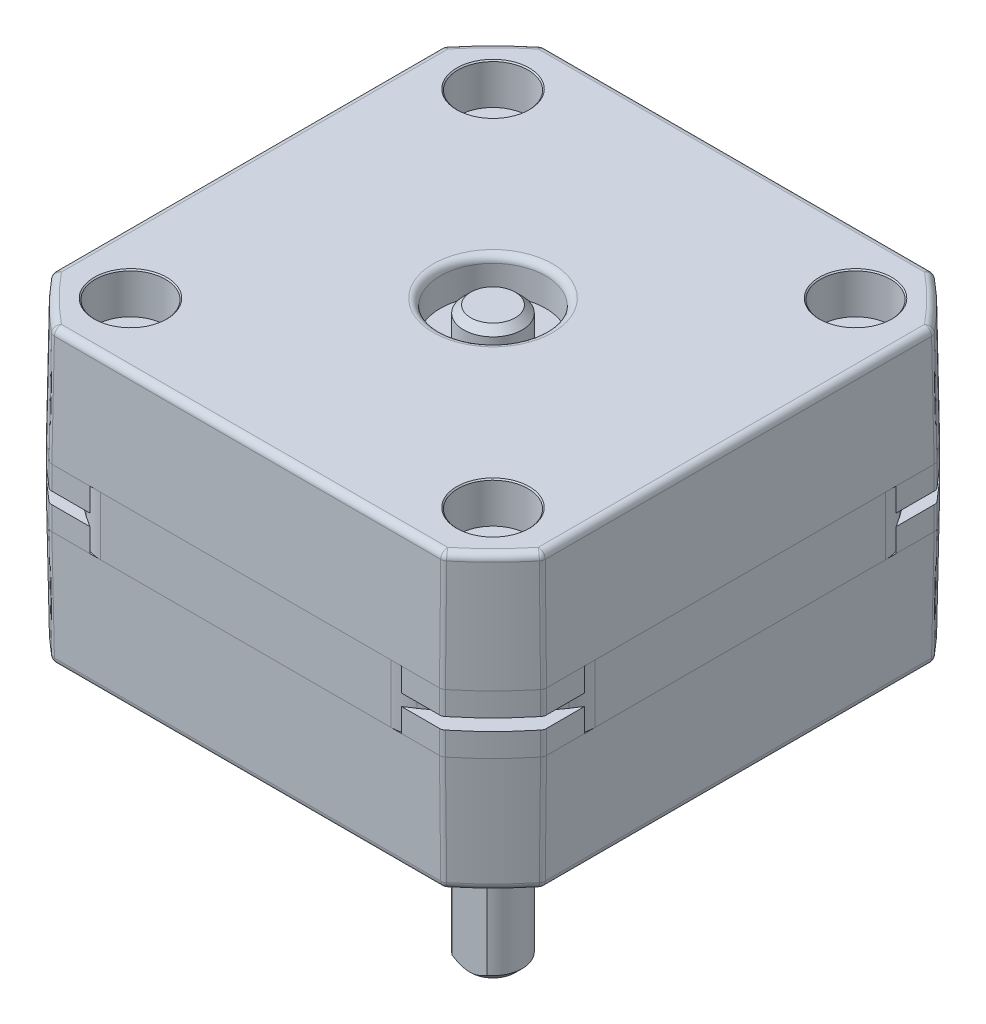
from build123d import *

# Parameters (mm, degrees)
SKETCH1_R                                   = 17.5
SKETCH1_R_2                                 = 1.75
CENTER_BODY_DEPTH                           = 5
TOP_CAP_BODY_DEPTH                          = 10
TOP_CAP_BODY_DRAFT                          = 1
TOP_CAP_BODY_OTHER_WAY_DEPTH                = 2
CUT_EXTRUDE1_START                          = -2
SKETCH4_R                                   = 25
CUT_EXTRUDE1_DEPTH                          = 2
FILLET3_R                                   = 3
CBORE_SLOT_FOR_M5_HEX_HEAD_BOLT1_AT_2_COUNT = 2
CBORE_SLOT_FOR_M5_HEX_HEAD_BOLT1_AT_2_PITCH = 31
CBORE_SLOT_FOR_M5_HEX_HEAD_BOLT1_AT_3_COUNT = 2
CBORE_SLOT_FOR_M5_HEX_HEAD_BOLT1_AT_3_PITCH = 43.840620434
CBORE_SLOT_FOR_M5_HEX_HEAD_BOLT1_AT_4_COUNT = 2
CBORE_SLOT_FOR_M5_HEX_HEAD_BOLT1_AT_4_PITCH = 31
SKETCH5_R                                   = 15.5
CUT_EXTRUDE2_DEPTH                          = 0.4
CUT_EXTRUDE2_DRAFT                          = -75
BOSS_EXTRUDE3_START                         = -0.4
SKETCH6_R                                   = 11
BOSS_EXTRUDE3_DEPTH                         = 2.4
M3_TAPPED_HOLE1_AT_2_COUNT                  = 2
M3_TAPPED_HOLE1_AT_2_PITCH                  = 31
M3_TAPPED_HOLE1_AT_3_COUNT                  = 2
M3_TAPPED_HOLE1_AT_3_PITCH                  = 43.840620434
M3_TAPPED_HOLE1_AT_4_COUNT                  = 2
M3_TAPPED_HOLE1_AT_4_PITCH                  = 31
SKETCH14_R                                  = 4.5
CUT_EXTRUDE3_DEPTH                          = 3
SKETCH15_R                                  = 2.5
BOSS_EXTRUDE4_DEPTH                         = 2.5
SKETCH16_R                                  = 4.5
CUT_EXTRUDE4_DEPTH                          = 3
SKETCH17_R                                  = 2.5
BOSS_EXTRUDE5_DEPTH                         = 25
CUT_EXTRUDE5_DEPTH                          = 20
SKETCH19_W                                  = 8
SKETCH19_H                                  = 7
CUT_EXTRUDE6_DEPTH                          = 4
FILLET1_R                                   = 0.6
FILLET2_R                                   = 0.6
CHAMFER1_SIZE                               = 0.6


with BuildPart() as part:
    # Sketch1 → center body (new body)
    with BuildSketch(Plane(origin=(0, 0, 0), x_dir=(1, 0, 0), z_dir=(0, 1, 0))):
        with BuildLine():
            Line((-21.15, 13.329572386), (-21.15, -13.329572386))
            ThreePointArc((-21.15, -13.329572386), (-17.67766953, -17.67766953), (-13.329572386, -21.15))
            Line((-13.329572386, -21.15), (13.329572386, -21.15))
            ThreePointArc((13.329572386, -21.15), (17.67766953, -17.67766953), (21.15, -13.329572386))
            Line((21.15, -13.329572386), (21.15, 13.329572386))
            ThreePointArc((21.15, 13.329572386), (17.67766953, 17.67766953), (13.329572386, 21.15))
            Line((13.329572386, 21.15), (-13.329572386, 21.15))
            ThreePointArc((-13.329572386, 21.15), (-17.67766953, 17.67766953), (-21.15, 13.329572386))
        make_face()
        with Locations(Location((0, 0, 0), (0, 0, 270))):
            Circle(SKETCH1_R, mode=Mode.SUBTRACT)
        with Locations(Location((-15.5, 15.5, 0), (0, 0, 270))):
            Circle(SKETCH1_R_2, mode=Mode.SUBTRACT)
        with Locations(Location((15.5, 15.5, 0), (0, 0, 90))):
            Circle(SKETCH1_R_2, mode=Mode.SUBTRACT)
        with Locations(Location((-15.5, -15.5, 0), (0, 0, 270))):
            Circle(SKETCH1_R_2, mode=Mode.SUBTRACT)
        with Locations(Location((15.5, -15.5, 0), (0, 0, 270))):
            Circle(SKETCH1_R_2, mode=Mode.SUBTRACT)
    extrude(amount=CENTER_BODY_DEPTH)

    # Fillet3
    fillet3_edges = [part.edges().sort_by_distance(p)[0] for p in [
        (21.15, 2.5, -13.329572386),
        (21.15, 2.5, 13.329572386),
        (13.329572386, 2.5, 21.15),
        (-13.329572386, 2.5, 21.15),
        (-21.15, 2.5, 13.329572386),
        (-21.15, 2.5, -13.329572386),
        (-13.329572386, 2.5, -21.15),
        (13.329572386, 2.5, -21.15),
    ]]
    fillet(fillet3_edges, radius=FILLET3_R)


with BuildPart() as body_2:
    # Sketch2 → top cap body (with draft: the straight prism first)
    with BuildSketch(Plane.XZ):
        with BuildLine():
            Line((-21.15, 16.783250579), (-21.15, -16.783250579))
            ThreePointArc((-21.15, -16.783250579), (-19.091883092, -19.091883092), (-16.783250579, -21.15))
            Line((-16.783250579, -21.15), (16.783250579, -21.15))
            ThreePointArc((16.783250579, -21.15), (19.091883092, -19.091883092), (21.15, -16.783250579))
            Line((21.15, -16.783250579), (21.15, 16.783250579))
            ThreePointArc((21.15, 16.783250579), (19.091883092, 19.091883092), (16.783250579, 21.15))
            Line((16.783250579, 21.15), (-16.783250579, 21.15))
            ThreePointArc((-16.783250579, 21.15), (-19.091883092, 19.091883092), (-21.15, 16.783250579))
        make_face()
    extrude(amount=TOP_CAP_BODY_DEPTH)
    # top cap body: the draft: its side faces are tilted about the plane it starts from
    top_cap_body_sides = [body_2.faces().sort_by_distance(p)[0] for p in [
        (-19.091883092, -5, 19.091883092),
        (-21.15, -5, 0),
        (-19.091883092, -5, -19.091883092),
        (0, -5, -21.15),
        (19.091883092, -5, -19.091883092),
        (21.15, -5, 0),
        (19.091883092, -5, 19.091883092),
        (0, -5, 21.15),
    ]]
    draft(top_cap_body_sides, Plane.XZ, TOP_CAP_BODY_DRAFT)

    # Sketch2 → top cap body other way (add)
    with BuildSketch(Plane.XZ):
        with BuildLine():
            Line((-21.15, 16.783250579), (-21.15, -16.783250579))
            ThreePointArc((-21.15, -16.783250579), (-19.091883092, -19.091883092), (-16.783250579, -21.15))
            Line((-16.783250579, -21.15), (16.783250579, -21.15))
            ThreePointArc((16.783250579, -21.15), (19.091883092, -19.091883092), (21.15, -16.783250579))
            Line((21.15, -16.783250579), (21.15, 16.783250579))
            ThreePointArc((21.15, 16.783250579), (19.091883092, 19.091883092), (16.783250579, 21.15))
            Line((16.783250579, 21.15), (-16.783250579, 21.15))
            ThreePointArc((-16.783250579, 21.15), (-19.091883092, 19.091883092), (-21.15, 16.783250579))
        make_face()
    extrude(amount=-TOP_CAP_BODY_OTHER_WAY_DEPTH)

    # Sketch4 → Cut-Extrude1 (cut)
    with BuildSketch(Plane(origin=(0, 2, 0), x_dir=(1, 0, 0), z_dir=(0, 1, 0)).offset(CUT_EXTRUDE1_START)):
        Circle(SKETCH4_R)
    extrude(amount=CUT_EXTRUDE1_DEPTH, mode=Mode.SUBTRACT)


with BuildPart() as body_3:
    # bottom cap: mirrored copy
    add(body_2.part.mirror(Plane(origin=(0, 2.5, 0), x_dir=(0, 0, 1), z_dir=(0, -1, 0))))

    # Sketch10 → CBORE SLOT for M5 Hex Head Bolt1 (revolve, cut)
    with BuildSketch(Plane(origin=(-15.5, 15, -15.5), x_dir=(0, 0, 1), z_dir=(1, 0, 0))):
        Polygon((0, 0), (0, 12.96037699), (1.6, 11.999), (1.6, 3.5), (3, 3.5), (3, 0.1), (3.1, 0), align=None)
    cbore_slot_for_m5_hex_head_bolt1 = revolve(axis=Axis((-15.5, 21.35, -15.5), (0, -1, 0)), mode=Mode.SUBTRACT)

    # CBORE SLOT for M5 Hex Head Bolt1 at 2: CBORE SLOT for M5 Hex Head Bolt1 ×2
    with Locations(*[(i * CBORE_SLOT_FOR_M5_HEX_HEAD_BOLT1_AT_2_PITCH, 0, 0) for i in range(1, CBORE_SLOT_FOR_M5_HEX_HEAD_BOLT1_AT_2_COUNT)]):
        add(cbore_slot_for_m5_hex_head_bolt1, mode=Mode.SUBTRACT)

    # CBORE SLOT for M5 Hex Head Bolt1 at 3: CBORE SLOT for M5 Hex Head Bolt1 ×2
    with Locations(*[Vector(0.7071067811865476, 0, 0.7071067811865476) * (i * CBORE_SLOT_FOR_M5_HEX_HEAD_BOLT1_AT_3_PITCH) for i in range(1, CBORE_SLOT_FOR_M5_HEX_HEAD_BOLT1_AT_3_COUNT)]):
        add(cbore_slot_for_m5_hex_head_bolt1, mode=Mode.SUBTRACT)

    # CBORE SLOT for M5 Hex Head Bolt1 at 4: CBORE SLOT for M5 Hex Head Bolt1 ×2
    with Locations(*[(0, 0, i * CBORE_SLOT_FOR_M5_HEX_HEAD_BOLT1_AT_4_PITCH) for i in range(1, CBORE_SLOT_FOR_M5_HEX_HEAD_BOLT1_AT_4_COUNT)]):
        add(cbore_slot_for_m5_hex_head_bolt1, mode=Mode.SUBTRACT)

    # Sketch14 → Cut-Extrude3 (cut)
    with BuildSketch(Plane(origin=(0, 15, 0), x_dir=(1, 0, 0), z_dir=(0, 1, 0))):
        with Locations(Location((0, 0, 0), (0, 0, 270))):
            Circle(SKETCH14_R)
    extrude(amount=-CUT_EXTRUDE3_DEPTH, mode=Mode.SUBTRACT)

    # Sketch15 → Boss-Extrude4 (add)
    with BuildSketch(Plane(origin=(0, 12, 0), x_dir=(1, 0, 0), z_dir=(0, 1, 0))):
        with Locations(Location((0, 0, 0), (0, 0, 270))):
            Circle(SKETCH15_R)
    extrude(amount=BOSS_EXTRUDE4_DEPTH)


with BuildPart() as cut_extrude2_tool:
    # Sketch5 → Cut-Extrude2 (with draft: the straight prism first)
    with BuildSketch(Plane.XZ.offset(10)):
        Circle(SKETCH5_R)
    extrude(amount=-CUT_EXTRUDE2_DEPTH)
    # Cut-Extrude2: the draft: its side faces are tilted about the plane it starts from
    cut_extrude2_sides = [cut_extrude2_tool.faces().sort_by_distance(p)[0] for p in [
        (-15.5, -9.8, 0),
    ]]
    draft(cut_extrude2_sides, Plane.XZ.offset(10), CUT_EXTRUDE2_DRAFT)


with BuildPart() as body_2_1:
    add(body_2.part)

    # Cut-Extrude2: cut by cut_extrude2_tool
    add(cut_extrude2_tool.part, mode=Mode.SUBTRACT)

    # Sketch6 → Boss-Extrude3 (add)
    with BuildSketch(Plane.XZ.offset(10).offset(BOSS_EXTRUDE3_START)):
        with Locations(Location((0, 0, 0), (0, 0, 270))):
            Circle(SKETCH6_R)
    extrude(amount=BOSS_EXTRUDE3_DEPTH)

    # Sketch13 → M3 Tapped Hole1 (revolve, cut)
    with BuildSketch(Plane(origin=(15.5, -10, -15.5), x_dir=(0, 0, -1), z_dir=(1, 0, 0))):
        Polygon((0, 0), (0, 12.750075774), (1.25, 11.999), (1.25, 0.45), (1.7, 0), align=None)
    m3_tapped_hole1 = revolve(axis=Axis((15.5, -16.35, -15.5), (0, 1, 0)), mode=Mode.SUBTRACT)

    # M3 Tapped Hole1 at 2: M3 Tapped Hole1 ×2
    with Locations(*[(-i * M3_TAPPED_HOLE1_AT_2_PITCH, 0, 0) for i in range(1, M3_TAPPED_HOLE1_AT_2_COUNT)]):
        add(m3_tapped_hole1, mode=Mode.SUBTRACT)

    # M3 Tapped Hole1 at 3: M3 Tapped Hole1 ×2
    with Locations(*[Vector(-0.7071067811865476, 0, 0.7071067811865475) * (i * M3_TAPPED_HOLE1_AT_3_PITCH) for i in range(1, M3_TAPPED_HOLE1_AT_3_COUNT)]):
        add(m3_tapped_hole1, mode=Mode.SUBTRACT)

    # M3 Tapped Hole1 at 4: M3 Tapped Hole1 ×2
    with Locations(*[(0, 0, i * M3_TAPPED_HOLE1_AT_4_PITCH) for i in range(1, M3_TAPPED_HOLE1_AT_4_COUNT)]):
        add(m3_tapped_hole1, mode=Mode.SUBTRACT)

    # Sketch16 → Cut-Extrude4 (cut)
    with BuildSketch(Plane.XZ.offset(12)):
        with Locations(Location((0, 0, 0), (0, 0, 90))):
            Circle(SKETCH16_R)
    extrude(amount=-CUT_EXTRUDE4_DEPTH, mode=Mode.SUBTRACT)

    # Sketch17 → Boss-Extrude5 (add)
    with BuildSketch(Plane.XZ.offset(9)):
        with Locations(Location((0, 0, 0), (0, 0, 90))):
            Circle(SKETCH17_R)
    extrude(amount=BOSS_EXTRUDE5_DEPTH)

    # Sketch18 → Cut-Extrude5 (cut)
    with BuildSketch(Plane.XZ.offset(34)):
        with BuildLine():
            Line((-1.5, 2), (1.5, 2))
            ThreePointArc((1.5, 2), (0, 2.5), (-1.5, 2))
        make_face()
    extrude(amount=-CUT_EXTRUDE5_DEPTH, mode=Mode.SUBTRACT)

    # Fillet1
    fillet1_edges = [body_2_1.edges().sort_by_distance(p)[0] for p in [
        (0, -12, -4.5),
        (16.783250579, 1, -21.15),
        (-16.783250579, 1, -21.15),
        (-21.15, 1, -16.783250579),
        (-21.15, 1, 16.783250579),
        (-16.783250579, 1, 21.15),
        (16.783250579, 1, 21.15),
        (21.15, 1, 16.783250579),
        (21.15, 1, -16.783250579),
        (16.752802114, -5.000000169, -21.062724672),
        (21.062724672, -5.000000169, -16.752802114),
        (21.062724672, -5.000000169, 16.752802114),
        (16.752802114, -5.000000169, 21.062724672),
        (-16.752802114, -5.000000169, 21.062724672),
        (-21.062724672, -5.000000169, 16.752802114),
        (-21.062724672, -5.000000169, -16.752802114),
        (-16.752802114, -5.000000169, -21.062724672),
        (18.968457144, -10, -18.968457144),
        (20.975449351, -10, 0),
        (18.968457144, -10, 18.968457144),
        (0, -10, 20.975449351),
        (-18.968457144, -10, 18.968457144),
        (-20.975449351, -10, 0),
        (-18.968457144, -10, -18.968457144),
        (0, -10, -20.975449351),
        (0, -12, 11),
    ]]
    fillet(fillet1_edges, radius=FILLET1_R)

    # Chamfer2: read off the stored shape, not the designer's step
    # Chamfer2 outline → Chamfer2 (revolve, cut)
    with BuildSketch(Plane.XY):
        Polygon((2.5, -33.4), (1.9, -34), (2.5, -34), align=None)
    revolve(axis=Axis((0, 0, 0), (0, 1, 0)), mode=Mode.SUBTRACT)


with BuildPart() as cut_extrude6_tool:
    # Sketch19 → Cut-Extrude6 (new body)
    with BuildSketch(Plane(origin=(0, 0.37058511, -21.230806737), x_dir=(-1, 0, 0), z_dir=(0, 0.01745240643728355, -0.9998476951563913))):
        with Locations((0, 8.13012008)):
            Rectangle(SKETCH19_W, SKETCH19_H)
    extrude(amount=-CUT_EXTRUDE6_DEPTH)


with BuildPart() as part_1:
    add(part.part)

    # Cut-Extrude6: cut by cut_extrude6_tool
    add(cut_extrude6_tool.part, mode=Mode.SUBTRACT)


with BuildPart() as body_3_1:
    add(body_3.part)

    # Cut-Extrude6: cut by cut_extrude6_tool
    add(cut_extrude6_tool.part, mode=Mode.SUBTRACT)

    # Fillet2
    fillet2_edges = [body_3_1.edges().sort_by_distance(p)[0] for p in [
        (16.783250579, 4, -21.15),
        (-16.783250579, 4, -21.15),
        (-21.15, 4, -16.783250579),
        (-21.15, 4, 16.783250579),
        (-16.783250579, 4, 21.15),
        (16.783250579, 4, 21.15),
        (0, 15, -4.5),
        (21.15, 4, 16.783250579),
        (21.15, 4, -16.783250579),
        (4, 5, -19.149695344),
        (-4, 5, -19.149695344),
        (16.752802114, 10.000000169, -21.062724672),
        (21.062724672, 10.000000169, -16.752802114),
        (21.062724672, 10.000000169, 16.752802114),
        (16.752802114, 10.000000169, 21.062724672),
        (-16.752802114, 10.000000169, 21.062724672),
        (-21.062724672, 10.000000169, 16.752802114),
        (-21.062724672, 10.000000169, -16.752802114),
        (-16.752802114, 10.000000169, -21.062724672),
        (18.968457144, 15, -18.968457144),
        (20.975449351, 15, 0),
        (18.968457144, 15, 18.968457144),
        (0, 15, 20.975449351),
        (-18.968457144, 15, 18.968457144),
        (-20.975449351, 15, 0),
        (-18.968457144, 15, -18.968457144),
        (0, 15, -20.975449351),
    ]]
    fillet(fillet2_edges, radius=FILLET2_R)

    # Chamfer1
    chamfer1_edges = [body_3_1.edges().sort_by_distance(p)[0] for p in [
        (0, 14.5, -2.5),
    ]]
    chamfer(chamfer1_edges, length=CHAMFER1_SIZE)


solid = Compound([body_2_1.part, part_1.part, body_3_1.part])
